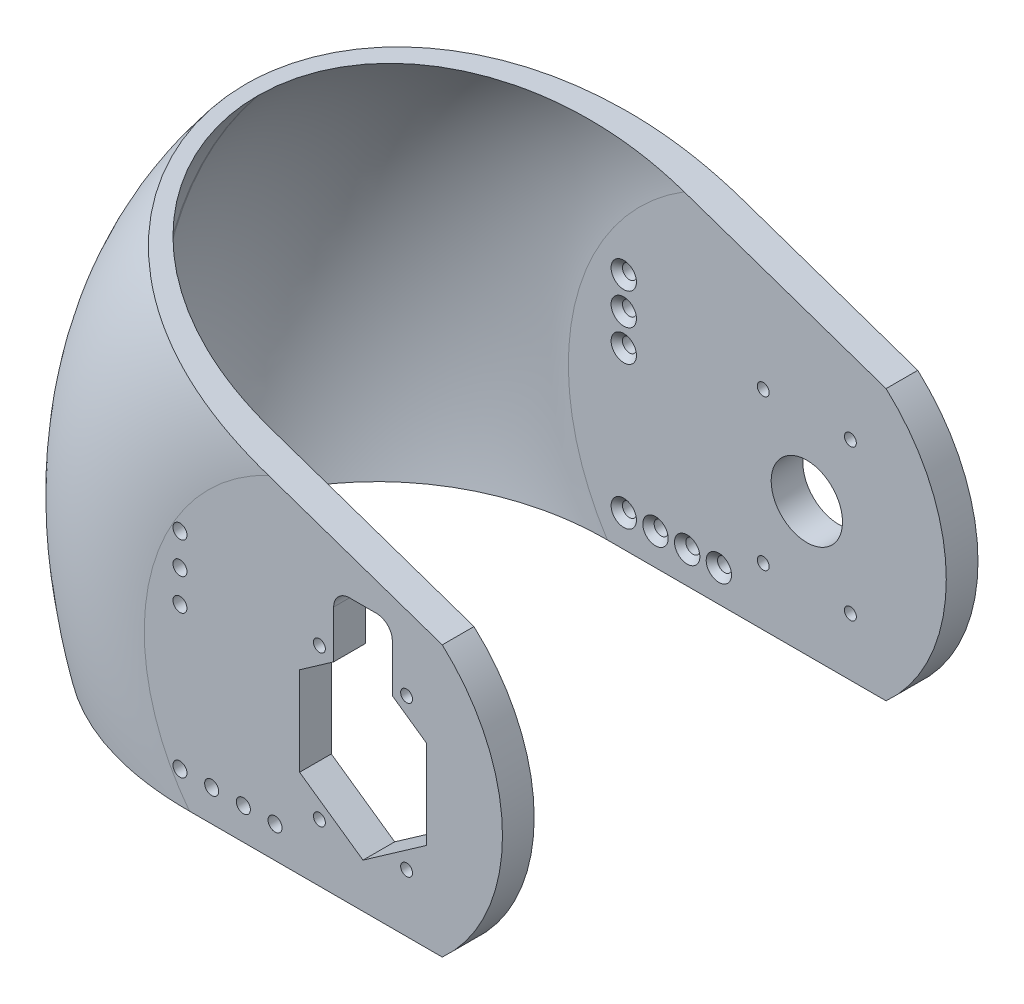
from build123d import *

# Parameters (mm, degrees)
SKETCH1_R                                          = 14.287500000000003
SKETCH1_R_2                                        = 2.3812500000000005
SKETCH1_R_3                                        = 2.3812500000000023
BOSS_EXTRUDE1_DEPTH                                = 190.5
CUT_EXTRUDE1_DEPTH                                 = 314.11990818452256
BOSS_EXTRUDE2_DEPTH                                = 165.1
CUT_EXTRUDE3_REACH                                 = 289.993
FILLET2_R                                          = 82.296
FILLET3_R                                          = 95.25
CSK_FOR_10_FLAT_HEAD_MACHINE_SCREW_100_D           = 5.6134
CSK_FOR_10_FLAT_HEAD_MACHINE_SCREW_100_DEPTH       = 21.30479447
CSK_FOR_10_FLAT_HEAD_MACHINE_SCREW_100_CSINK_D     = 10.16
CSK_FOR_10_FLAT_HEAD_MACHINE_SCREW_100_CSINK_ANGLE = 90


with BuildPart() as part:
    # Sketch1 → Boss-Extrude1 (new body)
    with BuildSketch(Plane.XY):
        with BuildLine():
            Line((31.75000000000027, -53.33999999999999), (-174.9283819167147, -53.33999999999997))
            ThreePointArc((-174.9283819167147, -53.33999999999997), (-179.52896718087996, 34.848878647189125), (-142.26850918824246, 114.91199107732386))
            Line((-142.26850918824246, 114.91199107732386), (31.750000000000263, 54.99261314031172))
            ThreePointArc((31.750000000000263, 54.99261314031172), (55.88000000000002, 0.8263065701558671), (31.75000000000027, -53.33999999999999))
        make_face()
        Circle(SKETCH1_R, mode=Mode.SUBTRACT)
        with Locations((-17.4625, 30.162499999999998)):
            Circle(SKETCH1_R_2, mode=Mode.SUBTRACT)
        with Locations((17.4625, 30.162499999999998)):
            Circle(SKETCH1_R_3, mode=Mode.SUBTRACT)
        with Locations((17.4625, -30.162499999999998)):
            Circle(SKETCH1_R_3, mode=Mode.SUBTRACT)
        with Locations((-17.462499999999995, -30.162499999999998)):
            Circle(SKETCH1_R_2, mode=Mode.SUBTRACT)
    extrude(amount=-BOSS_EXTRUDE1_DEPTH)

    # Sketch2 → Cut-Extrude1 (cut, through all)
    with BuildSketch(Plane.XZ.offset(53.33999999999999)):
        Polygon((-182.87999999999997, -12.7), (55.88000000000002, -12.699999999999989), (55.88000000000004, -177.79999999999998), (-182.87999999999997, -177.79999999999998), align=None)
    extrude(amount=-CUT_EXTRUDE1_DEPTH, mode=Mode.SUBTRACT)


with BuildPart() as cut_extrude1_piece_1:
    # of the separate pieces the step leaves, piece 1, a body of its own (cut_extrude1_pieces)
    add(part.part.solids().sort_by_distance((31.75, 54.99261314, -177.8))[0])



with BuildPart() as cut_extrude1_piece_2:
    # of the separate pieces the step leaves, piece 2, a body of its own (cut_extrude1_pieces)
    add(part.part.solids().sort_by_distance((-142.268509188, 114.911991077, 0))[0])


with BuildPart() as cut_extrude1_piece_1_1:
    add(cut_extrude1_piece_1.part)

    add(cut_extrude1_piece_2.part)  # Boss-Extrude2 merges Cut-Extrude1 piece 2
    # Sketch3 → Boss-Extrude2 (add)
    with BuildSketch(Plane.XY.offset(-177.79999999999998)):
        with BuildLine():
            Line((-142.26850918824255, 114.9119910773238), (-137.46527482419802, 113.25810485268146))
            ThreePointArc((-137.46527482419802, 113.25810485268146), (-174.51803717575487, 34.01402507695267), (-169.84838191671497, -53.33999999999914))
            Line((-169.84838191671497, -53.33999999999914), (-174.92838191671498, -53.339999999999144))
            ThreePointArc((-174.92838191671498, -53.339999999999144), (-179.52896718087993, 34.84887864718949), (-142.26850918824255, 114.9119910773238))
        make_face()
    extrude(amount=BOSS_EXTRUDE2_DEPTH)

    # Sketch5 → Cut-Extrude3 (cut, up to next)
    with BuildSketch(Plane.XY, mode=Mode.PRIVATE) as cut_extrude3_sk1:
        with BuildLine():
            Line((-25.399999999999995, 17.779999999999998), (-25.4, -17.779999999999998))
            Line((-25.4, -17.779999999999998), (9.71e-15, -35.56527147052652))
            Line((9.71e-15, -35.56527147052652), (25.400000000000002, -17.78))
            Line((25.400000000000002, -17.78), (25.400000000000002, 17.779999999999998))
            Line((25.400000000000002, 17.779999999999998), (11.747499999999985, 27.33958341540801))
            Line((11.747499999999985, 27.33958341540801), (11.747499999999983, 46.38958341540796))
            ThreePointArc((11.747499999999983, 46.38958341540796), (9.88762806053456, 50.879711475942585), (5.397499999999937, 52.739583415408006))
            Line((5.397499999999937, 52.739583415408006), (-5.397499999999977, 52.739583415408006))
            ThreePointArc((-5.397499999999977, 52.739583415408006), (-9.887628060534599, 50.879711475942585), (-11.747500000000022, 46.38958341540796))
            Line((-11.747500000000022, 46.38958341540796), (-11.74750000000002, 27.33958341540801))
            Line((-11.74750000000002, 27.33958341540801), (-25.399999999999995, 17.779999999999998))
        make_face()
    cut_extrude3_tool1 = extrude(cut_extrude3_sk1.sketch, amount=-CUT_EXTRUDE3_REACH, mode=Mode.PRIVATE) & cut_extrude1_piece_1_1.part
    add(cut_extrude3_tool1.solids().sort_by_distance((0, 6.295319, 0))[0], mode=Mode.SUBTRACT)

    # Fillet2
    fillet2_edges = [cut_extrude1_piece_1_1.edges().sort_by_distance(p)[0] for p in [
        (-174.51803717575484, 34.014025076952706, -12.699999999999989),
        (-174.51803717575484, 34.014025076952706, -177.79999999999998),
    ]]
    fillet(fillet2_edges, radius=FILLET2_R)

    # Fillet3
    fillet3_edges = [cut_extrude1_piece_1_1.edges().sort_by_distance(p)[0] for p in [
        (-179.52896718087993, 34.848878647189096, -190.5),
        (-179.52896718087993, 34.848878647189096, 0),
    ]]
    fillet(fillet3_edges, radius=FILLET3_R - 0.0001)  # a hair under: the kernel refuses the full size

    # CSK for #10 Flat Head Machine Screw (100)12
    with Locations(Plane(origin=(5.5e-16, 0, -12.69999999999999), x_dir=(-1, 0, 0), z_dir=(0, 0, -1))):
        with Locations((35.228381917, -40.64), (73.328381917, 29.21), (73.328381917, 41.91), (73.328381917, 16.51), (60.628381917, -40.64), (73.328381917, -40.64), (47.928381917, -40.64)):
            csk_for_10_flat_head_machine_screw_100 = CounterSinkHole(CSK_FOR_10_FLAT_HEAD_MACHINE_SCREW_100_D / 2, CSK_FOR_10_FLAT_HEAD_MACHINE_SCREW_100_CSINK_D / 2, depth=CSK_FOR_10_FLAT_HEAD_MACHINE_SCREW_100_DEPTH, counter_sink_angle=CSK_FOR_10_FLAT_HEAD_MACHINE_SCREW_100_CSINK_ANGLE)

    # Mirror1: CSK for #10 Flat Head Machine Screw (100)12 across plane
    add(csk_for_10_flat_head_machine_screw_100.mirror(Plane(origin=(2.08e-15, 0, -95.24999999999999), x_dir=(1, 0, 0), z_dir=(0, 0, -1))), mode=Mode.SUBTRACT)


solid = cut_extrude1_piece_1_1.part
